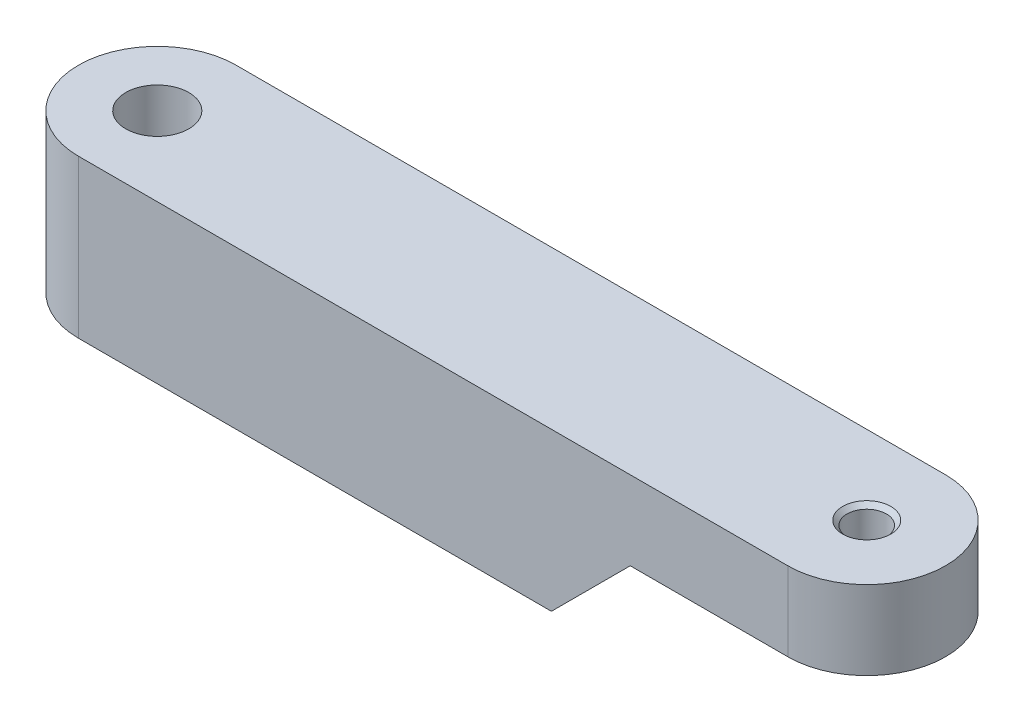
from build123d import *

# Parameters (mm, degrees)
ESQUISSE1_R                     = 2
BOSS_EXTRU_1_DEPTH              = 5
TROU_TARAUD_M3X0_51_D           = 2.5
TROU_TARAUD_M3X0_51_CSINK_D     = 3.05
TROU_TARAUD_M3X0_51_CSINK_ANGLE = 90
ENL_V_MAT_EXTRU_1_DEPTH         = 51.497524692
ENL_V_MAT_EXTRU_1_DEPTH_BACK    = 51.497524692


with BuildPart() as part:
    # Esquisse1 → Boss.-Extru.1 (new, symmetric)
    with BuildSketch(Plane(origin=(0, 0, 0), x_dir=(1, 0, 0), z_dir=(0, 1, 0))):
        with BuildLine():
            Line((0, 5), (45, 5))
            ThreePointArc((45, 5), (50, 0), (45, -5))
            Line((45, -5), (0, -5))
            ThreePointArc((0, -5), (-5, 0), (0, 5))
        make_face()
        Circle(ESQUISSE1_R, mode=Mode.SUBTRACT)
    extrude(amount=BOSS_EXTRU_1_DEPTH, both=True)

    # Trou taraudé M3x0.51 (through all)
    with Locations(Plane(origin=(0, 5, 0), x_dir=(1, 0, 0), z_dir=(0, 1, 0))):
        with Locations((45, 0)):
            CounterSinkHole(TROU_TARAUD_M3X0_51_D / 2, TROU_TARAUD_M3X0_51_CSINK_D / 2, counter_sink_angle=TROU_TARAUD_M3X0_51_CSINK_ANGLE)

    # Esquisse4 → Enlèv. mat.-Extru.1 (cut, two sides: drawn at the far end of the back side and taken through both)
    with BuildSketch(Plane.XY.offset(-ENL_V_MAT_EXTRU_1_DEPTH_BACK)):
        Polygon((35, 0), (50, 0), (50, -5), (30, -5), align=None)
    extrude(amount=ENL_V_MAT_EXTRU_1_DEPTH + ENL_V_MAT_EXTRU_1_DEPTH_BACK, mode=Mode.SUBTRACT)


solid = part.part
